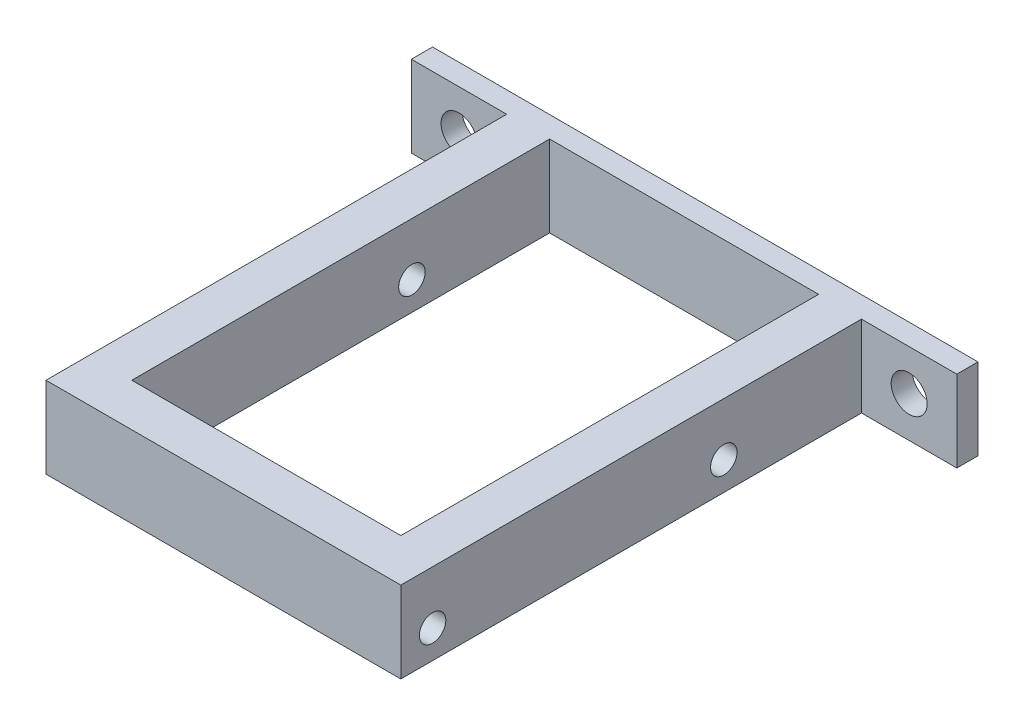
from build123d import *

# Parameters (mm, degrees)
SKETCH25_W                          = 25.4
SKETCH25_H                          = 39.45
BOSS_EXTRUDE5_DEPTH                 = 7.68
M3X0_5_TAPPED_HOLE2_D               = 2.5
M3X0_5_TAPPED_HOLE2_DEPTH           = 7.62
M3X0_5_TAPPED_HOLE2_TIP             = 0.751075774
M3X0_5_TAPPED_HOLE2_ON_FACE_2_D     = 2.5
M3X0_5_TAPPED_HOLE2_ON_FACE_2_DEPTH = 7.62
M3X0_5_TAPPED_HOLE2_ON_FACE_2_TIP   = 0.751075774
M3_CLEARANCE_HOLE3_D                = 3.4


with BuildPart() as part:
    # Sketch25 → Boss-Extrude5 (new body)
    with BuildSketch(Plane(origin=(0, 0, 0), x_dir=(1, 0, 0), z_dir=(0, 1, 0))):
        Polygon((25.75, 28.75), (-25.75, 28.75), (-25.75, 26.75), (-16.75, 26.75), (-16.75, -16.75), (16.75, -16.75), (16.75, 26.75), (25.75, 26.75), align=None)
        with Locations((0, 7.025)):
            Rectangle(SKETCH25_W, SKETCH25_H, mode=Mode.SUBTRACT)
    extrude(amount=-BOSS_EXTRUDE5_DEPTH)

    # M3x0.5 Tapped Hole2
    with Locations(Plane(origin=(16.75, -5, 13.75), x_dir=(0, 0, 1), z_dir=(1, 0, 0))):
        with Locations((0, 0), (-27.5, 0)):
            Hole(M3X0_5_TAPPED_HOLE2_D / 2, depth=M3X0_5_TAPPED_HOLE2_DEPTH)
            with Locations((0, 0, -(M3X0_5_TAPPED_HOLE2_DEPTH + M3X0_5_TAPPED_HOLE2_TIP / 2))):  # 118° drill point
                Cone(0, M3X0_5_TAPPED_HOLE2_D / 2, M3X0_5_TAPPED_HOLE2_TIP, mode=Mode.SUBTRACT)

    # M3x0.5 Tapped Hole2 on face 2
    with Locations(Plane(origin=(-16.75, -5, -13.75), x_dir=(0, 0, -1), z_dir=(-1, 0, 0))):
        with Locations((0, 0), (-27.5, 0)):
            Hole(M3X0_5_TAPPED_HOLE2_ON_FACE_2_D / 2, depth=M3X0_5_TAPPED_HOLE2_ON_FACE_2_DEPTH)
            with Locations((0, 0, -(M3X0_5_TAPPED_HOLE2_ON_FACE_2_DEPTH + M3X0_5_TAPPED_HOLE2_ON_FACE_2_TIP / 2))):  # 118° drill point
                Cone(0, M3X0_5_TAPPED_HOLE2_ON_FACE_2_D / 2, M3X0_5_TAPPED_HOLE2_ON_FACE_2_TIP, mode=Mode.SUBTRACT)

    # M3 Clearance Hole3 (through all)
    with Locations(Plane(origin=(21.25, -3.84, -26.75), x_dir=(1, 0, 0), z_dir=(0, 0, 1))):
        with Locations((0, 0), (-42.5, 0)):
            Hole(M3_CLEARANCE_HOLE3_D / 2)


solid = part.part
